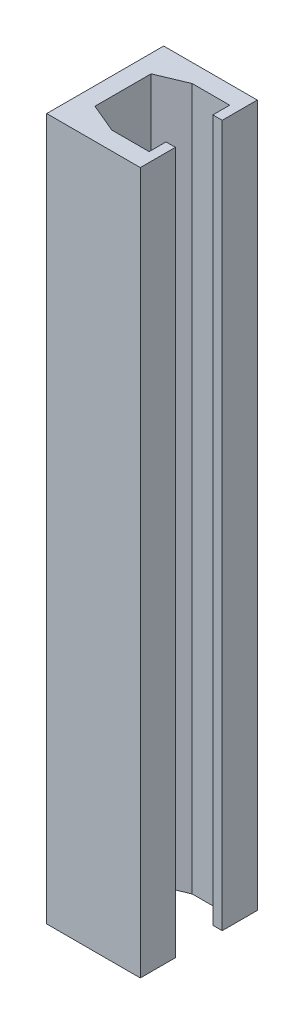
from build123d import *

# Parameters (mm, degrees)
BOSS_EXTRUDE2_DEPTH = 150


with BuildPart() as part:
    # Sketch1 → Boss-Extrude2 (new body)
    with BuildSketch(Plane(origin=(0, 0, 0), x_dir=(1, 0, 0), z_dir=(0, 1, 0))):
        Polygon((-10, 12.5), (-10, -12.5), (10, -12.5), (10, -5), (8, -5), (8, -8.6), (0, -8.6), (-6.2, -6), (-6.2, 0), (-6.2, 6), (0, 8.6), (8, 8.6), (8, 5), (10, 5), (10, 12.5), align=None)
    extrude(amount=BOSS_EXTRUDE2_DEPTH)


solid = part.part
